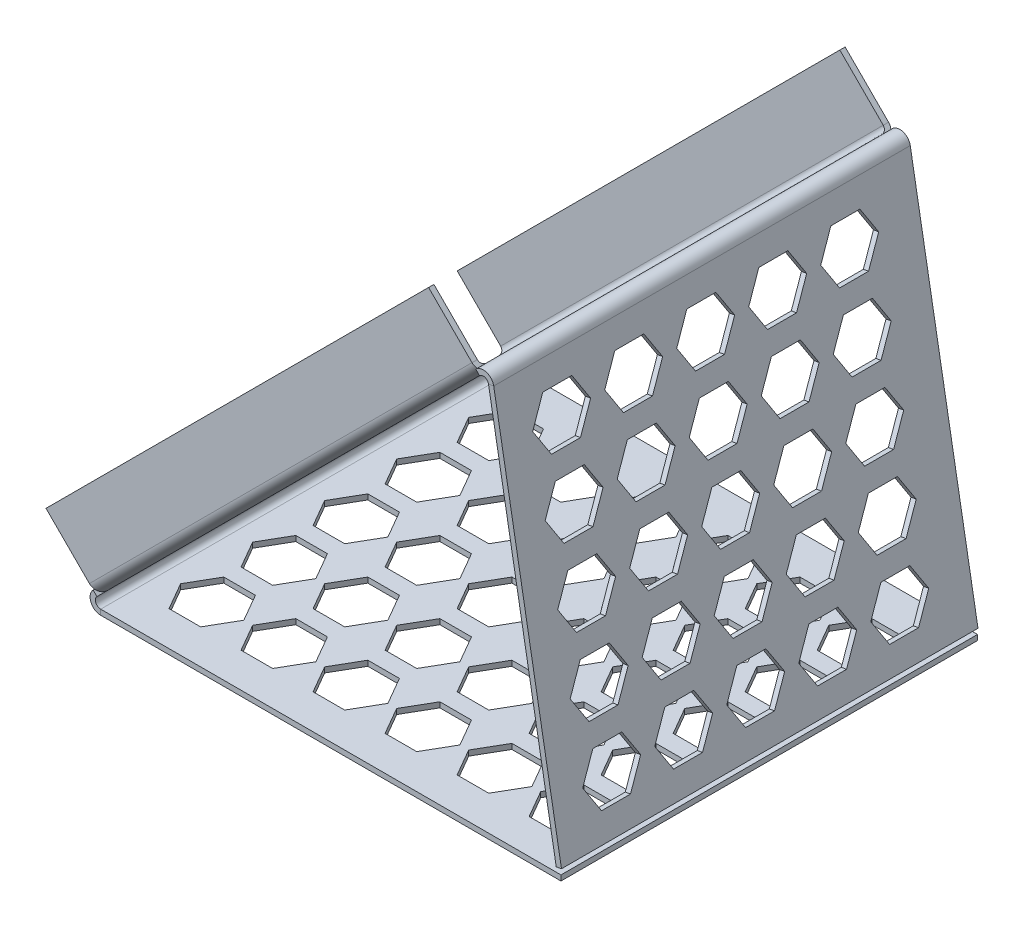
from build123d import *

# Parameters (mm, degrees)
SKETCH2_W                      = 66.735039583
SKETCH2_H                      = 57.835984368
BASE_FLANGE1_DEPTH             = 0.7366
EDGE_FLANGE1_DEPTH             = 57.835984368
EDGE_FLANGE1_2_DEPTH           = 57.835984368
EDGE_FLANGE2_DEPTH             = 57.835984368
EDGE_FLANGE2_2_DEPTH           = 57.835984368
CUT_EXTRUDE1_DEPTH             = 0.7366
CUT_EXTRUDE2_DEPTH             = 0.7366
CUT_EXTRUDE3_DEPTH             = 0.7366
EDGE_FLANGE3_STRIP_W           = 4.4196
EDGE_FLANGE3_STRIP_H           = 0.7366
EDGE_FLANGE3_STRIP_CUT_DEPTH   = 75.129162583
EDGE_FLANGE3_STRIP_2_W         = 4.4196
EDGE_FLANGE3_STRIP_2_H         = 0.7366
EDGE_FLANGE3_STRIP_CUT_2_DEPTH = 75.129162583
EDGE_FLANGE3_DEPTH             = 75.129162583
EDGE_FLANGE3_BEND_DEPTH        = 75.129162583


# Read off the part's stored shape, not the designer's step: Edge-Flange1, Edge-Flange2
# Sheet-metal steps are written as plain solids
with BuildPart() as part:
    # Sketch2 → Base-Flange1 (new body)
    with BuildSketch(Plane(origin=(0, 0, 0), x_dir=(1, 0, 0), z_dir=(0, 1, 0))):
        with Locations((33.367519792, -28.917992184)):
            Rectangle(SKETCH2_W, SKETCH2_H)
    extrude(amount=-BASE_FLANGE1_DEPTH)

    # Edge-Flange1 outline → Edge-Flange1 (cut)
    with BuildSketch(Plane.XY):
        with BuildLine():
            ThreePointArc((2.82001942, -0.7366), (2.08341942, -0.539228625), (1.544190795, 0))
            Line((1.544190795, 0), (0, 0))
            Line((0, 0), (0, -0.7366))
            Line((0, -0.7366), (2.82001942, -0.7366))
        make_face()
    extrude(amount=EDGE_FLANGE1_DEPTH, mode=Mode.SUBTRACT)

    # Edge-Flange1 2 outline → Edge-Flange1 2 (add)
    with BuildSketch(Plane.XY):
        with BuildLine():
            Line((56.539049276, 56.539049276), (1.77830971, 1.77830971))
            ThreePointArc((1.77830971, 1.77830971), (1.35942285, 0.928891186), (1.544190795, 0))
            Line((1.544190795, 0), (2.82001942, 0))
            ThreePointArc((2.82001942, 0), (2.139489756, 0.454715384), (2.299164565, 1.257454855))
            Line((2.299164565, 1.257454855), (57.059904131, 56.018194421))
            Line((57.059904131, 56.018194421), (56.539049276, 56.539049276))
        make_face()
    extrude(amount=EDGE_FLANGE1_2_DEPTH)

    # Edge-Flange2 outline → Edge-Flange2 (cut)
    with BuildSketch(Plane.XY):
        with BuildLine():
            ThreePointArc((54.902650037, 54.902650037), (55.56306753, 55.283942254), (56.325651964, 55.283942254))
            Line((56.325651964, 55.283942254), (57.059904131, 56.018194421))
            Line((57.059904131, 56.018194421), (56.539049276, 56.539049276))
            Line((56.539049276, 56.539049276), (54.902650037, 54.902650037))
        make_face()
    extrude(amount=EDGE_FLANGE2_DEPTH, mode=Mode.SUBTRACT)

    # Edge-Flange2 2 outline → Edge-Flange2 2 (add)
    with BuildSketch(Plane.XY):
        with BuildLine():
            Line((66.801701899, 0.76971385), (57.395178529, 54.116758823))
            ThreePointArc((57.395178529, 54.116758823), (57.03051672, 54.856219821), (56.325651964, 55.283942254))
            Line((56.325651964, 55.283942254), (55.423504892, 54.381795182))
            ThreePointArc((55.423504892, 54.381795182), (56.165859639, 54.563448233), (56.669769138, 53.988849575))
            Line((56.669769138, 53.988849575), (66.076292508, 0.641804603))
            Line((66.076292508, 0.641804603), (66.801701899, 0.76971385))
        make_face()
    extrude(amount=EDGE_FLANGE2_2_DEPTH)

    # Sketch14 → Cut-Extrude1 (cut)
    with BuildSketch(Plane(origin=(0, 0, 0), x_dir=(0, 0, 1), z_dir=(-0.7071067811865487, 0.7071067811865465, 0))):
        Polygon((22.950647928, 70.328725873), (20.756690263, 74.128772018), (16.368774932, 74.128772018), (14.174817267, 70.328725873), (16.368774932, 66.528679727), (20.756690263, 66.528679727), align=None)
        Polygon((12.950647928, 70.328725873), (10.756690263, 74.128772018), (6.368774932, 74.128772018), (4.174817267, 70.328725873), (6.368774932, 66.528679727), (10.756690263, 66.528679727), align=None)
        Polygon((32.950647928, 70.328725873), (30.756690263, 74.128772018), (26.368774932, 74.128772018), (24.174817267, 70.328725873), (26.368774932, 66.528679727), (30.756690263, 66.528679727), align=None)
        Polygon((42.950647928, 70.328725873), (40.756690263, 74.128772018), (36.368774932, 74.128772018), (34.174817267, 70.328725873), (36.368774932, 66.528679727), (40.756690263, 66.528679727), align=None)
        Polygon((52.950647928, 70.328725873), (50.756690263, 74.128772018), (46.368774932, 74.128772018), (44.174817267, 70.328725873), (46.368774932, 66.528679727), (50.756690263, 66.528679727), align=None)
        Polygon((22.950647928, 60.328725873), (20.756690263, 64.128772018), (16.368774932, 64.128772018), (14.174817267, 60.328725873), (16.368774932, 56.528679727), (20.756690263, 56.528679727), align=None)
        Polygon((32.950647928, 60.328725873), (30.756690263, 64.128772018), (26.368774932, 64.128772018), (24.174817267, 60.328725873), (26.368774932, 56.528679727), (30.756690263, 56.528679727), align=None)
        Polygon((42.950647928, 60.328725873), (40.756690263, 64.128772018), (36.368774932, 64.128772018), (34.174817267, 60.328725873), (36.368774932, 56.528679727), (40.756690263, 56.528679727), align=None)
        Polygon((52.950647928, 60.328725873), (50.756690263, 64.128772018), (46.368774932, 64.128772018), (44.174817267, 60.328725873), (46.368774932, 56.528679727), (50.756690263, 56.528679727), align=None)
        Polygon((22.950647928, 50.328725873), (20.756690263, 54.128772018), (16.368774932, 54.128772018), (14.174817267, 50.328725873), (16.368774932, 46.528679727), (20.756690263, 46.528679727), align=None)
        Polygon((32.950647928, 50.328725873), (30.756690263, 54.128772018), (26.368774932, 54.128772018), (24.174817267, 50.328725873), (26.368774932, 46.528679727), (30.756690263, 46.528679727), align=None)
        Polygon((42.950647928, 50.328725873), (40.756690263, 54.128772018), (36.368774932, 54.128772018), (34.174817267, 50.328725873), (36.368774932, 46.528679727), (40.756690263, 46.528679727), align=None)
        Polygon((52.950647928, 50.328725873), (50.756690263, 54.128772018), (46.368774932, 54.128772018), (44.174817267, 50.328725873), (46.368774932, 46.528679727), (50.756690263, 46.528679727), align=None)
        Polygon((22.950647928, 40.328725873), (20.756690263, 44.128772018), (16.368774932, 44.128772018), (14.174817267, 40.328725873), (16.368774932, 36.528679727), (20.756690263, 36.528679727), align=None)
        Polygon((32.950647928, 40.328725873), (30.756690263, 44.128772018), (26.368774932, 44.128772018), (24.174817267, 40.328725873), (26.368774932, 36.528679727), (30.756690263, 36.528679727), align=None)
        Polygon((42.950647928, 40.328725873), (40.756690263, 44.128772018), (36.368774932, 44.128772018), (34.174817267, 40.328725873), (36.368774932, 36.528679727), (40.756690263, 36.528679727), align=None)
        Polygon((52.950647928, 40.328725873), (50.756690263, 44.128772018), (46.368774932, 44.128772018), (44.174817267, 40.328725873), (46.368774932, 36.528679727), (50.756690263, 36.528679727), align=None)
        Polygon((22.950647928, 30.328725873), (20.756690263, 34.128772018), (16.368774932, 34.128772018), (14.174817267, 30.328725873), (16.368774932, 26.528679727), (20.756690263, 26.528679727), align=None)
        Polygon((32.950647928, 30.328725873), (30.756690263, 34.128772018), (26.368774932, 34.128772018), (24.174817267, 30.328725873), (26.368774932, 26.528679727), (30.756690263, 26.528679727), align=None)
        Polygon((42.950647928, 30.328725873), (40.756690263, 34.128772018), (36.368774932, 34.128772018), (34.174817267, 30.328725873), (36.368774932, 26.528679727), (40.756690263, 26.528679727), align=None)
        Polygon((52.950647928, 30.328725873), (50.756690263, 34.128772018), (46.368774932, 34.128772018), (44.174817267, 30.328725873), (46.368774932, 26.528679727), (50.756690263, 26.528679727), align=None)
        Polygon((22.950647928, 20.328725873), (20.756690263, 24.128772018), (16.368774932, 24.128772018), (14.174817267, 20.328725873), (16.368774932, 16.528679727), (20.756690263, 16.528679727), align=None)
        Polygon((32.950647928, 20.328725873), (30.756690263, 24.128772018), (26.368774932, 24.128772018), (24.174817267, 20.328725873), (26.368774932, 16.528679727), (30.756690263, 16.528679727), align=None)
        Polygon((42.950647928, 20.328725873), (40.756690263, 24.128772018), (36.368774932, 24.128772018), (34.174817267, 20.328725873), (36.368774932, 16.528679727), (40.756690263, 16.528679727), align=None)
        Polygon((52.950647928, 20.328725873), (50.756690263, 24.128772018), (46.368774932, 24.128772018), (44.174817267, 20.328725873), (46.368774932, 16.528679727), (50.756690263, 16.528679727), align=None)
        Polygon((22.950647928, 10.328725873), (20.756690263, 14.128772018), (16.368774932, 14.128772018), (14.174817267, 10.328725873), (16.368774932, 6.528679727), (20.756690263, 6.528679727), align=None)
        Polygon((32.950647928, 10.328725873), (30.756690263, 14.128772018), (26.368774932, 14.128772018), (24.174817267, 10.328725873), (26.368774932, 6.528679727), (30.756690263, 6.528679727), align=None)
        Polygon((42.950647928, 10.328725873), (40.756690263, 14.128772018), (36.368774932, 14.128772018), (34.174817267, 10.328725873), (36.368774932, 6.528679727), (40.756690263, 6.528679727), align=None)
        Polygon((52.950647928, 10.328725873), (50.756690263, 14.128772018), (46.368774932, 14.128772018), (44.174817267, 10.328725873), (46.368774932, 6.528679727), (50.756690263, 6.528679727), align=None)
        Polygon((12.950647928, 60.328725873), (10.756690263, 64.128772018), (6.368774932, 64.128772018), (4.174817267, 60.328725873), (6.368774932, 56.528679727), (10.756690263, 56.528679727), align=None)
        Polygon((12.950647928, 50.328725873), (10.756690263, 54.128772018), (6.368774932, 54.128772018), (4.174817267, 50.328725873), (6.368774932, 46.528679727), (10.756690263, 46.528679727), align=None)
        Polygon((12.950647928, 40.328725873), (10.756690263, 44.128772018), (6.368774932, 44.128772018), (4.174817267, 40.328725873), (6.368774932, 36.528679727), (10.756690263, 36.528679727), align=None)
        Polygon((12.950647928, 30.328725873), (10.756690263, 34.128772018), (6.368774932, 34.128772018), (4.174817267, 30.328725873), (6.368774932, 26.528679727), (10.756690263, 26.528679727), align=None)
        Polygon((12.950647928, 20.328725873), (10.756690263, 24.128772018), (6.368774932, 24.128772018), (4.174817267, 20.328725873), (6.368774932, 16.528679727), (10.756690263, 16.528679727), align=None)
        Polygon((12.950647928, 10.328725873), (10.756690263, 14.128772018), (6.368774932, 14.128772018), (4.174817267, 10.328725873), (6.368774932, 6.528679727), (10.756690263, 6.528679727), align=None)
    extrude(amount=-CUT_EXTRUDE1_DEPTH, mode=Mode.SUBTRACT)

    # Sketch15 → Cut-Extrude2 (cut)
    with BuildSketch(Plane(origin=(0, 0, 0), x_dir=(1, 0, 0), z_dir=(0, 1, 0))):
        Polygon((24.08761605, -49.22549322), (21.892917594, -45.424163987), (17.503520683, -45.424163987), (15.308822227, -49.22549322), (17.503520683, -53.026822452), (21.892917594, -53.026822452), align=None)
        Polygon((14.08761605, -49.22549322), (11.892917594, -45.424163987), (7.503520683, -45.424163987), (5.308822227, -49.22549322), (7.503520683, -53.026822452), (11.892917594, -53.026822452), align=None)
        Polygon((34.08761605, -49.22549322), (31.892917594, -45.424163987), (27.503520683, -45.424163987), (25.308822227, -49.22549322), (27.503520683, -53.026822452), (31.892917594, -53.026822452), align=None)
        Polygon((44.08761605, -49.22549322), (41.892917594, -45.424163987), (37.503520683, -45.424163987), (35.308822227, -49.22549322), (37.503520683, -53.026822452), (41.892917594, -53.026822452), align=None)
        Polygon((54.08761605, -49.22549322), (51.892917594, -45.424163987), (47.503520683, -45.424163987), (45.308822227, -49.22549322), (47.503520683, -53.026822452), (51.892917594, -53.026822452), align=None)
        Polygon((64.08761605, -49.22549322), (61.892917594, -45.424163987), (57.503520683, -45.424163987), (55.308822227, -49.22549322), (57.503520683, -53.026822452), (61.892917594, -53.026822452), align=None)
        Polygon((24.08761605, -39.22549322), (21.892917594, -35.424163987), (17.503520683, -35.424163987), (15.308822227, -39.22549322), (17.503520683, -43.026822452), (21.892917594, -43.026822452), align=None)
        Polygon((34.08761605, -39.22549322), (31.892917594, -35.424163987), (27.503520683, -35.424163987), (25.308822227, -39.22549322), (27.503520683, -43.026822452), (31.892917594, -43.026822452), align=None)
        Polygon((44.08761605, -39.22549322), (41.892917594, -35.424163987), (37.503520683, -35.424163987), (35.308822227, -39.22549322), (37.503520683, -43.026822452), (41.892917594, -43.026822452), align=None)
        Polygon((54.08761605, -39.22549322), (51.892917594, -35.424163987), (47.503520683, -35.424163987), (45.308822227, -39.22549322), (47.503520683, -43.026822452), (51.892917594, -43.026822452), align=None)
        Polygon((64.08761605, -39.22549322), (61.892917594, -35.424163987), (57.503520683, -35.424163987), (55.308822227, -39.22549322), (57.503520683, -43.026822452), (61.892917594, -43.026822452), align=None)
        Polygon((24.08761605, -29.22549322), (21.892917594, -25.424163987), (17.503520683, -25.424163987), (15.308822227, -29.22549322), (17.503520683, -33.026822452), (21.892917594, -33.026822452), align=None)
        Polygon((34.08761605, -29.22549322), (31.892917594, -25.424163987), (27.503520683, -25.424163987), (25.308822227, -29.22549322), (27.503520683, -33.026822452), (31.892917594, -33.026822452), align=None)
        Polygon((44.08761605, -29.22549322), (41.892917594, -25.424163987), (37.503520683, -25.424163987), (35.308822227, -29.22549322), (37.503520683, -33.026822452), (41.892917594, -33.026822452), align=None)
        Polygon((54.08761605, -29.22549322), (51.892917594, -25.424163987), (47.503520683, -25.424163987), (45.308822227, -29.22549322), (47.503520683, -33.026822452), (51.892917594, -33.026822452), align=None)
        Polygon((64.08761605, -29.22549322), (61.892917594, -25.424163987), (57.503520683, -25.424163987), (55.308822227, -29.22549322), (57.503520683, -33.026822452), (61.892917594, -33.026822452), align=None)
        Polygon((24.08761605, -19.22549322), (21.892917594, -15.424163987), (17.503520683, -15.424163987), (15.308822227, -19.22549322), (17.503520683, -23.026822452), (21.892917594, -23.026822452), align=None)
        Polygon((34.08761605, -19.22549322), (31.892917594, -15.424163987), (27.503520683, -15.424163987), (25.308822227, -19.22549322), (27.503520683, -23.026822452), (31.892917594, -23.026822452), align=None)
        Polygon((44.08761605, -19.22549322), (41.892917594, -15.424163987), (37.503520683, -15.424163987), (35.308822227, -19.22549322), (37.503520683, -23.026822452), (41.892917594, -23.026822452), align=None)
        Polygon((54.08761605, -19.22549322), (51.892917594, -15.424163987), (47.503520683, -15.424163987), (45.308822227, -19.22549322), (47.503520683, -23.026822452), (51.892917594, -23.026822452), align=None)
        Polygon((64.08761605, -19.22549322), (61.892917594, -15.424163987), (57.503520683, -15.424163987), (55.308822227, -19.22549322), (57.503520683, -23.026822452), (61.892917594, -23.026822452), align=None)
        Polygon((24.08761605, -9.22549322), (21.892917594, -5.424163987), (17.503520683, -5.424163987), (15.308822227, -9.22549322), (17.503520683, -13.026822452), (21.892917594, -13.026822452), align=None)
        Polygon((34.08761605, -9.22549322), (31.892917594, -5.424163987), (27.503520683, -5.424163987), (25.308822227, -9.22549322), (27.503520683, -13.026822452), (31.892917594, -13.026822452), align=None)
        Polygon((44.08761605, -9.22549322), (41.892917594, -5.424163987), (37.503520683, -5.424163987), (35.308822227, -9.22549322), (37.503520683, -13.026822452), (41.892917594, -13.026822452), align=None)
        Polygon((54.08761605, -9.22549322), (51.892917594, -5.424163987), (47.503520683, -5.424163987), (45.308822227, -9.22549322), (47.503520683, -13.026822452), (51.892917594, -13.026822452), align=None)
        Polygon((64.08761605, -9.22549322), (61.892917594, -5.424163987), (57.503520683, -5.424163987), (55.308822227, -9.22549322), (57.503520683, -13.026822452), (61.892917594, -13.026822452), align=None)
        Polygon((14.08761605, -39.22549322), (11.892917594, -35.424163987), (7.503520683, -35.424163987), (5.308822227, -39.22549322), (7.503520683, -43.026822452), (11.892917594, -43.026822452), align=None)
        Polygon((14.08761605, -29.22549322), (11.892917594, -25.424163987), (7.503520683, -25.424163987), (5.308822227, -29.22549322), (7.503520683, -33.026822452), (11.892917594, -33.026822452), align=None)
        Polygon((14.08761605, -19.22549322), (11.892917594, -15.424163987), (7.503520683, -15.424163987), (5.308822227, -19.22549322), (7.503520683, -23.026822452), (11.892917594, -23.026822452), align=None)
        Polygon((14.08761605, -9.22549322), (11.892917594, -5.424163987), (7.503520683, -5.424163987), (5.308822227, -9.22549322), (7.503520683, -13.026822452), (11.892917594, -13.026822452), align=None)
    extrude(amount=-CUT_EXTRUDE2_DEPTH, mode=Mode.SUBTRACT)

    # Sketch16 → Cut-Extrude3 (cut)
    with BuildSketch(Plane(origin=(64.919012935, 11.446973541, 0), x_dir=(0, 0, -1), z_dir=(0.9848077530122075, 0.173648177666934, 0))):
        Polygon((-35.608848812, 36.26705088), (-37.620950885, 39.752113901), (-41.645155032, 39.752113901), (-43.657257105, 36.26705088), (-41.645155032, 32.781987858), (-37.620950885, 32.781987858), align=None)
        Polygon((-45.608848812, 36.26705088), (-47.620950885, 39.752113901), (-51.645155032, 39.752113901), (-53.657257105, 36.26705088), (-51.645155032, 32.781987858), (-47.620950885, 32.781987858), align=None)
        Polygon((-25.608848812, 36.26705088), (-27.620950885, 39.752113901), (-31.645155032, 39.752113901), (-33.657257105, 36.26705088), (-31.645155032, 32.781987858), (-27.620950885, 32.781987858), align=None)
        Polygon((-15.608848812, 36.26705088), (-17.620950885, 39.752113901), (-21.645155032, 39.752113901), (-23.657257105, 36.26705088), (-21.645155032, 32.781987858), (-17.620950885, 32.781987858), align=None)
        Polygon((-5.608848812, 36.26705088), (-7.620950885, 39.752113901), (-11.645155032, 39.752113901), (-13.657257105, 36.26705088), (-11.645155032, 32.781987858), (-7.620950885, 32.781987858), align=None)
        Polygon((-35.608848812, 26.26705088), (-37.620950885, 29.752113901), (-41.645155032, 29.752113901), (-43.657257105, 26.26705088), (-41.645155032, 22.781987858), (-37.620950885, 22.781987858), align=None)
        Polygon((-25.608848812, 26.26705088), (-27.620950885, 29.752113901), (-31.645155032, 29.752113901), (-33.657257105, 26.26705088), (-31.645155032, 22.781987858), (-27.620950885, 22.781987858), align=None)
        Polygon((-15.608848812, 26.26705088), (-17.620950885, 29.752113901), (-21.645155032, 29.752113901), (-23.657257105, 26.26705088), (-21.645155032, 22.781987858), (-17.620950885, 22.781987858), align=None)
        Polygon((-5.608848812, 26.26705088), (-7.620950885, 29.752113901), (-11.645155032, 29.752113901), (-13.657257105, 26.26705088), (-11.645155032, 22.781987858), (-7.620950885, 22.781987858), align=None)
        Polygon((-35.608848812, 16.26705088), (-37.620950885, 19.752113901), (-41.645155032, 19.752113901), (-43.657257105, 16.26705088), (-41.645155032, 12.781987858), (-37.620950885, 12.781987858), align=None)
        Polygon((-25.608848812, 16.26705088), (-27.620950885, 19.752113901), (-31.645155032, 19.752113901), (-33.657257105, 16.26705088), (-31.645155032, 12.781987858), (-27.620950885, 12.781987858), align=None)
        Polygon((-15.608848812, 16.26705088), (-17.620950885, 19.752113901), (-21.645155032, 19.752113901), (-23.657257105, 16.26705088), (-21.645155032, 12.781987858), (-17.620950885, 12.781987858), align=None)
        Polygon((-5.608848812, 16.26705088), (-7.620950885, 19.752113901), (-11.645155032, 19.752113901), (-13.657257105, 16.26705088), (-11.645155032, 12.781987858), (-7.620950885, 12.781987858), align=None)
        Polygon((-35.608848812, 6.26705088), (-37.620950885, 9.752113901), (-41.645155032, 9.752113901), (-43.657257105, 6.26705088), (-41.645155032, 2.781987858), (-37.620950885, 2.781987858), align=None)
        Polygon((-25.608848812, 6.26705088), (-27.620950885, 9.752113901), (-31.645155032, 9.752113901), (-33.657257105, 6.26705088), (-31.645155032, 2.781987858), (-27.620950885, 2.781987858), align=None)
        Polygon((-15.608848812, 6.26705088), (-17.620950885, 9.752113901), (-21.645155032, 9.752113901), (-23.657257105, 6.26705088), (-21.645155032, 2.781987858), (-17.620950885, 2.781987858), align=None)
        Polygon((-5.608848812, 6.26705088), (-7.620950885, 9.752113901), (-11.645155032, 9.752113901), (-13.657257105, 6.26705088), (-11.645155032, 2.781987858), (-7.620950885, 2.781987858), align=None)
        Polygon((-35.608848812, -3.73294912), (-37.620950885, -0.247886099), (-41.645155032, -0.247886099), (-43.657257105, -3.73294912), (-41.645155032, -7.218012142), (-37.620950885, -7.218012142), align=None)
        Polygon((-25.608848812, -3.73294912), (-27.620950885, -0.247886099), (-31.645155032, -0.247886099), (-33.657257105, -3.73294912), (-31.645155032, -7.218012142), (-27.620950885, -7.218012142), align=None)
        Polygon((-15.608848812, -3.73294912), (-17.620950885, -0.247886099), (-21.645155032, -0.247886099), (-23.657257105, -3.73294912), (-21.645155032, -7.218012142), (-17.620950885, -7.218012142), align=None)
        Polygon((-5.608848812, -3.73294912), (-7.620950885, -0.247886099), (-11.645155032, -0.247886099), (-13.657257105, -3.73294912), (-11.645155032, -7.218012142), (-7.620950885, -7.218012142), align=None)
        Polygon((-45.608848812, 26.26705088), (-47.620950885, 29.752113901), (-51.645155032, 29.752113901), (-53.657257105, 26.26705088), (-51.645155032, 22.781987858), (-47.620950885, 22.781987858), align=None)
        Polygon((-45.608848812, 16.26705088), (-47.620950885, 19.752113901), (-51.645155032, 19.752113901), (-53.657257105, 16.26705088), (-51.645155032, 12.781987858), (-47.620950885, 12.781987858), align=None)
        Polygon((-45.608848812, 6.26705088), (-47.620950885, 9.752113901), (-51.645155032, 9.752113901), (-53.657257105, 6.26705088), (-51.645155032, 2.781987858), (-47.620950885, 2.781987858), align=None)
        Polygon((-45.608848812, -3.73294912), (-47.620950885, -0.247886099), (-51.645155032, -0.247886099), (-53.657257105, -3.73294912), (-51.645155032, -7.218012142), (-47.620950885, -7.218012142), align=None)
    extrude(amount=-CUT_EXTRUDE3_DEPTH, mode=Mode.SUBTRACT)

    # Edge-Flange3 strip (across the edge) → Edge-Flange3 strip cut (cut)
    with BuildSketch(Plane(origin=(1.77830971, 1.77830971, 57.835984368), x_dir=(0, 0, -1), z_dir=(0.7071067811865462, 0.7071067811865489, 0))):
        with Locations((-0.7366, -0.3683)):
            Rectangle(EDGE_FLANGE3_STRIP_W, EDGE_FLANGE3_STRIP_H)
    extrude(amount=EDGE_FLANGE3_STRIP_CUT_DEPTH, mode=Mode.SUBTRACT)

    # Edge-Flange3 strip 2 (across the edge) → Edge-Flange3 strip cut 2 (cut)
    with BuildSketch(Plane(origin=(54.902650037, 54.902650037, 0), x_dir=(0, 0, 1), z_dir=(-0.7071067811865462, -0.7071067811865489, 0))):
        with Locations((-0.7366, -0.3683)):
            Rectangle(EDGE_FLANGE3_STRIP_2_W, EDGE_FLANGE3_STRIP_2_H)
    extrude(amount=EDGE_FLANGE3_STRIP_CUT_2_DEPTH, mode=Mode.SUBTRACT)

    # Edge-Flange3 section (across the edge) → Edge-Flange3 (add)
    with BuildSketch(Plane(origin=(1.77830971, 1.77830971, 57.835984368), x_dir=(0, 0, -1), z_dir=(0.7071067811865462, 0.7071067811865489, 0))):
        with BuildLine():
            Line((0, 0.7366), (0, 9.2634))
            Line((0, 9.2634), (0.7366, 9.2634))
            Line((0.7366, 9.2634), (0.7366, 0.7366))
            ThreePointArc((0.7366, 0.7366), (0.952345145, 0.215745145), (1.4732, 0))
            Line((1.4732, 0), (1.4732, -0.7366))
            ThreePointArc((1.4732, -0.7366), (0.43149029, -0.30510971), (0, 0.7366))
        make_face()
    extrude(amount=EDGE_FLANGE3_DEPTH)

    # Edge-Flange3 section 2 (across the edge) → Edge-Flange3 bend (add)
    with BuildSketch(Plane(origin=(54.902650037, 54.902650037, 0), x_dir=(0, 0, 1), z_dir=(-0.7071067811865462, -0.7071067811865489, 0))):
        with BuildLine():
            Line((0, 0.7366), (0, 9.2634))
            Line((0, 9.2634), (0.7366, 9.2634))
            Line((0.7366, 9.2634), (0.7366, 0.7366))
            ThreePointArc((0.7366, 0.7366), (0.952345145, 0.215745145), (1.4732, 0))
            Line((1.4732, 0), (1.4732, -0.7366))
            ThreePointArc((1.4732, -0.7366), (0.43149029, -0.30510971), (0, 0.7366))
        make_face()
    extrude(amount=EDGE_FLANGE3_BEND_DEPTH)


solid = part.part
